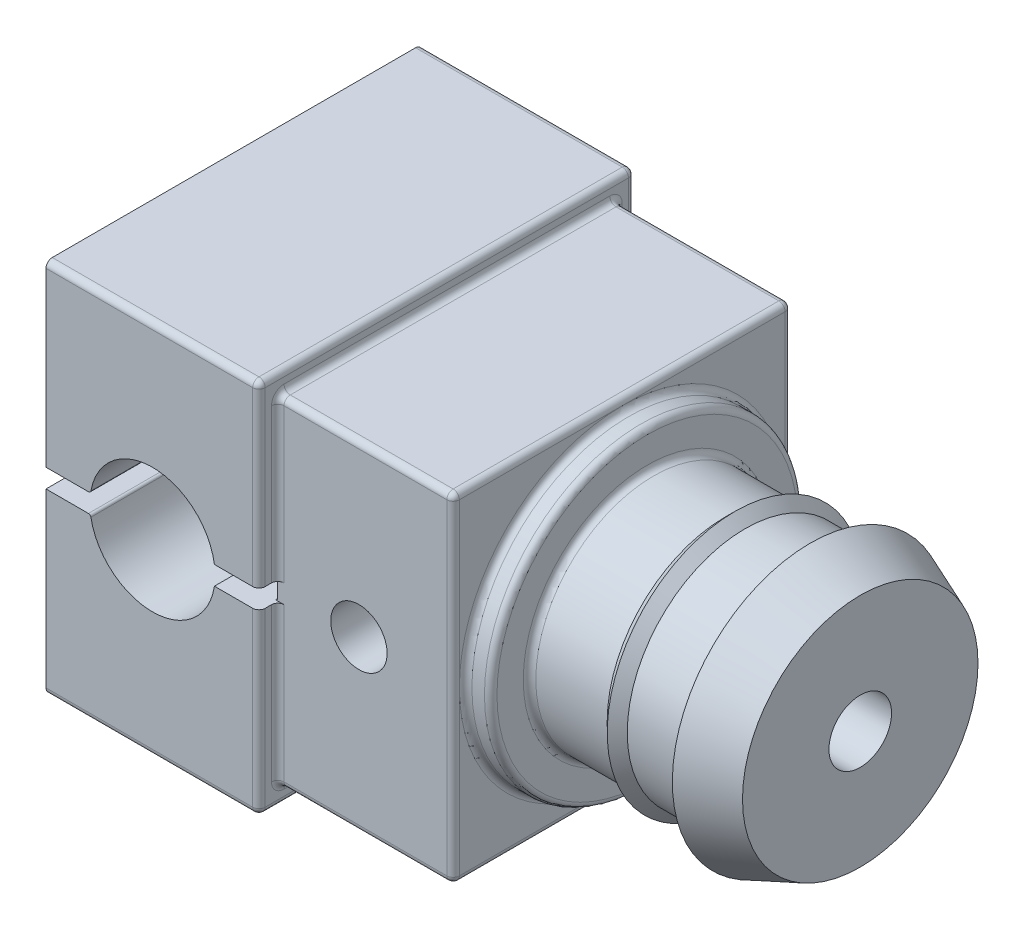
from build123d import *

# Parameters (mm, degrees)
SKETCH5_R           = 12.5
BOSS_EXTRUDE1_DEPTH = 2
SKETCH6_W           = 27
SKETCH6_H           = 27
BOSS_EXTRUDE2_DEPTH = 14
SKETCH8_W           = 30
SKETCH8_H           = 30
BOSS_EXTRUDE3_DEPTH = 17
SKETCH9_R           = 2.25
CUT_EXTRUDE1_DEPTH  = 16
SKETCH10_R          = 2.5
CUT_EXTRUDE2_DEPTH  = 26
CUT_EXTRUDE3_DEPTH  = 24
SKETCH15_R          = 5
CUT_EXTRUDE4_DEPTH  = 8
FILLET3_R           = 0.5
FILLET4_R           = 0.5
FILLET6_R           = 0.2


# Some blends are built 0.0001 mm under size
with BuildPart() as part:
    # Sketch4 → Revolve2 (revolve)
    with BuildSketch(Plane.XY):
        Polygon((0, 0), (0, 9.4), (6.2, 9.4), (7, 10.2), (7.8, 9.4), (13, 9.4), (13, 11), (17, 9.4), (17, 0), align=None)
    revolve(axis=Axis((17, 0, 0), (-1, 0, 0)))

    # Sketch5 → Boss-Extrude1 (add)
    with BuildSketch(Plane.ZY):
        Circle(SKETCH5_R)
    extrude(amount=BOSS_EXTRUDE1_DEPTH)

    # Sketch6 → Boss-Extrude2 (add)
    with BuildSketch(Plane.ZY.offset(2)):
        Rectangle(SKETCH6_W, SKETCH6_H)
    extrude(amount=BOSS_EXTRUDE2_DEPTH)

    # Sketch8 → Boss-Extrude3 (add)
    with BuildSketch(Plane.ZY.offset(16)):
        Rectangle(SKETCH8_W, SKETCH8_H)
    extrude(amount=BOSS_EXTRUDE3_DEPTH)

    # Sketch9 → Cut-Extrude1 (cut)
    with BuildSketch(Plane.XY.offset(13.5)):
        with Locations((-9.519550997, 0)):
            Circle(SKETCH9_R)
    extrude(amount=-CUT_EXTRUDE1_DEPTH, mode=Mode.SUBTRACT)

    # Sketch10 → Cut-Extrude2 (cut)
    with BuildSketch(Plane(origin=(17, 0, 0), x_dir=(0, 0, -1), z_dir=(1, 0, 0))):
        Circle(SKETCH10_R)
    extrude(amount=-CUT_EXTRUDE2_DEPTH, mode=Mode.SUBTRACT)

    # Sketch11 → Cut-Extrude3 (cut)
    with BuildSketch(Plane.XY.offset(15)):
        with BuildLine():
            Line((-20.469181225, 0.75), (-16, 0.75))
            Line((-16, 0.75), (-16, -0.75))
            Line((-16, -0.75), (-20.469181225, -0.75))
            ThreePointArc((-20.469181225, -0.75), (-24.5, -4.1), (-28.530818775, -0.75))
            Line((-28.530818775, -0.75), (-35.502796497, -0.75))
            Line((-35.502796497, -0.75), (-35.502796497, 0.75))
            Line((-35.502796497, 0.75), (-28.530818775, 0.75))
            ThreePointArc((-28.530818775, 0.75), (-24.5, 4.1), (-20.469181225, 0.75))
        make_face()
    extrude(amount=-CUT_EXTRUDE3_DEPTH, mode=Mode.SUBTRACT)

    # Sketch15 → Cut-Extrude4 (cut)
    with BuildSketch(Plane.XY.offset(15)):
        with Locations((-24.5, 0)):
            Circle(SKETCH15_R)
    extrude(amount=-CUT_EXTRUDE4_DEPTH, mode=Mode.SUBTRACT)

    # Fillet3
    fillet3_edges = [part.edges().sort_by_distance(p)[0] for p in [
        (0, -9.4, 0),
        (0, 0, -12.5),
        (-2, 0, -12.5),
        (-2, 0, 13.5),
        (-9, -13.5, 13.5),
        (-2, 13.5, 0),
        (-9, 13.5, 13.5),
        (-2, 0, -13.5),
        (-9, 13.5, -13.5),
        (-2, -13.5, 0),
        (-9, -13.5, -13.5),
        (-16, -7.125, 13.5),
        (-16, 13.5, 0),
        (-16, 0, -13.5),
        (-16, -13.5, 0),
        (-16, -7.875, 15),
        (-16, 0, -15),
        (-16, -15, 0),
        (-16, 7.125, 13.5),
        (-16, 7.875, 15),
    ]]
    fillet(fillet3_edges, radius=FILLET3_R - 0.0001)  # a hair under: the kernel refuses the full size

    # Fillet4
    # the kernel refuses this fillet: 0.5 mm, written as the material it takes off along each edge
    with BuildSketch(Plane(origin=(-16, -14.5, -14.5), x_dir=(0, -1, 0), z_dir=(0, 0, 1))) as fillet4_piece_1:
        with BuildLine():
            CenterArc((0.0001, -0.4999), 0.4999, 0, 90)
            Line((0.5, -0.4999), (0.5, 0))
            Line((0.5, 0), (0.0001, 0))
        make_face()
    revolve(axis=Axis((-16, -14.5, -14.5), (1, 0, 0)), revolution_arc=90, mode=Mode.SUBTRACT)
    with BuildSketch(Plane(origin=(-16, -14.5, 14.5), x_dir=(0, 0, 1), z_dir=(0, 1, 0))) as fillet4_piece_2:
        with BuildLine():
            CenterArc((0.0001, -0.4999), 0.4999, 0, 90)
            Line((0.5, -0.4999), (0.5, 0))
            Line((0.5, 0), (0.0001, 0))
        make_face()
    revolve(axis=Axis((-16, -14.5, 14.5), (1, 0, 0)), revolution_arc=90, mode=Mode.SUBTRACT)
    with BuildSketch(Plane(origin=(-16, 15, 15.7501), x_dir=(-1, 0, 0), z_dir=(0, 0, -1))) as fillet4_piece_3:
        with BuildLine():
            CenterArc((FILLET4_R, -FILLET4_R), FILLET4_R, 90, 90)
            Line((0, -FILLET4_R), (-FILLET4_R * 0.02, -FILLET4_R))
            Line((-FILLET4_R * 0.02, -FILLET4_R), (-FILLET4_R * 0.02, FILLET4_R * 0.02))
            Line((-FILLET4_R * 0.02, FILLET4_R * 0.02), (FILLET4_R, FILLET4_R * 0.02))
            Line((FILLET4_R, FILLET4_R * 0.02), (FILLET4_R, 0))
        make_face()
    extrude(amount=31.5002, mode=Mode.SUBTRACT)
    with BuildSketch(Plane(origin=(-16.4999, 15, -14.5001), x_dir=(0, 0, -1), z_dir=(-1, 0, 0))) as fillet4_piece_4:
        with BuildLine():
            CenterArc((-0.0001, 0.5), FILLET4_R, 270.011459156, 89.988540844)
            Line((0.4999, 0.5), (0.5099, 0.5))
            Line((0.5099, 0.5), (0.5099, -0.01))
            Line((0.5099, -0.01), (0, -0.01))
            Line((0, -0.01), (0, 1e-08))
        make_face()
    revolve(axis=Axis((-16.4999, 15, -14.5001), (0, -1, 0)), revolution_arc=90, mode=Mode.SUBTRACT)
    with BuildSketch(Plane(origin=(-16.4999, 15, 14.5001), x_dir=(1, 0, 0), z_dir=(0, 0, -1))) as fillet4_piece_5:
        with BuildLine():
            CenterArc((-0.0001, 0.5), FILLET4_R, 270.011459156, 89.988540844)
            Line((0.4999, 0.5), (0.5099, 0.5))
            Line((0.5099, 0.5), (0.5099, -0.01))
            Line((0.5099, -0.01), (0, -0.01))
            Line((0, -0.01), (0, 1e-08))
        make_face()
    revolve(axis=Axis((-16.4999, 15, 14.5001), (0, -1, 0)), revolution_arc=90, mode=Mode.SUBTRACT)
    with BuildSketch(Plane(origin=(-16, -15, 15), x_dir=(0, 0, -1), z_dir=(-1, 0, 0))) as fillet4_piece_6:
        with BuildLine():
            CenterArc((FILLET4_R, -FILLET4_R), FILLET4_R, 90, 90)
            Line((0, -FILLET4_R), (-FILLET4_R * 0.02, -FILLET4_R))
            Line((-FILLET4_R * 0.02, -FILLET4_R), (-FILLET4_R * 0.02, FILLET4_R * 0.02))
            Line((-FILLET4_R * 0.02, FILLET4_R * 0.02), (FILLET4_R, FILLET4_R * 0.02))
            Line((FILLET4_R, FILLET4_R * 0.02), (FILLET4_R, 0))
        make_face()
    extrude(amount=17, mode=Mode.SUBTRACT)
    with BuildSketch(Plane(origin=(-15.2499, 15, 15), x_dir=(0, 0, -1), z_dir=(-1, 0, 0)), Plane(origin=(-15.2499, 15, -15), x_dir=(0, -1, 0), z_dir=(-1, 0, 0))) as fillet4_piece_7:
        with BuildLine():
            CenterArc((FILLET4_R, FILLET4_R), FILLET4_R, 180, 90)
            Line((0, FILLET4_R), (-FILLET4_R * 0.02, FILLET4_R))
            Line((-FILLET4_R * 0.02, FILLET4_R), (-FILLET4_R * 0.02, -FILLET4_R * 0.02))
            Line((-FILLET4_R * 0.02, -FILLET4_R * 0.02), (FILLET4_R, -FILLET4_R * 0.02))
            Line((FILLET4_R, -FILLET4_R * 0.02), (FILLET4_R, 0))
        make_face()
    extrude(amount=17.7501, mode=Mode.SUBTRACT)
    with BuildSketch(Plane(origin=(-16, -15, -15), x_dir=(0, 0, 1), z_dir=(-1, 0, 0))) as fillet4_piece_8:
        with BuildLine():
            CenterArc((FILLET4_R, FILLET4_R), FILLET4_R, 180, 90)
            Line((0, FILLET4_R), (-FILLET4_R * 0.02, FILLET4_R))
            Line((-FILLET4_R * 0.02, FILLET4_R), (-FILLET4_R * 0.02, -FILLET4_R * 0.02))
            Line((-FILLET4_R * 0.02, -FILLET4_R * 0.02), (FILLET4_R, -FILLET4_R * 0.02))
            Line((FILLET4_R, -FILLET4_R * 0.02), (FILLET4_R, 0))
        make_face()
    extrude(amount=17, mode=Mode.SUBTRACT)

    # Fillet6
    fillet6_edges = [part.edges().sort_by_distance(p)[0] for p in [
        (-28.987124379, -0.75, 7),
        (-28.987124379, 0.75, 7),
        (-24.5, 4.1, -9),
        (-30.765409388, -0.75, -9),
        (-30.765409388, 0.75, -9),
        (-29.443429983, -0.75, 11),
        (-29.443429983, 0.75, 11),
        (-24.5, -4.1, 7),
        (-24.5, -5, 7),
        (-24.5, 4.1, 7),
        (-24.5, 5, 7),
        (-16, -0.75, 2.25),
        (-16, 0.75, 2.25),
    ]]
    fillet(fillet6_edges, radius=FILLET6_R)


solid = part.part
